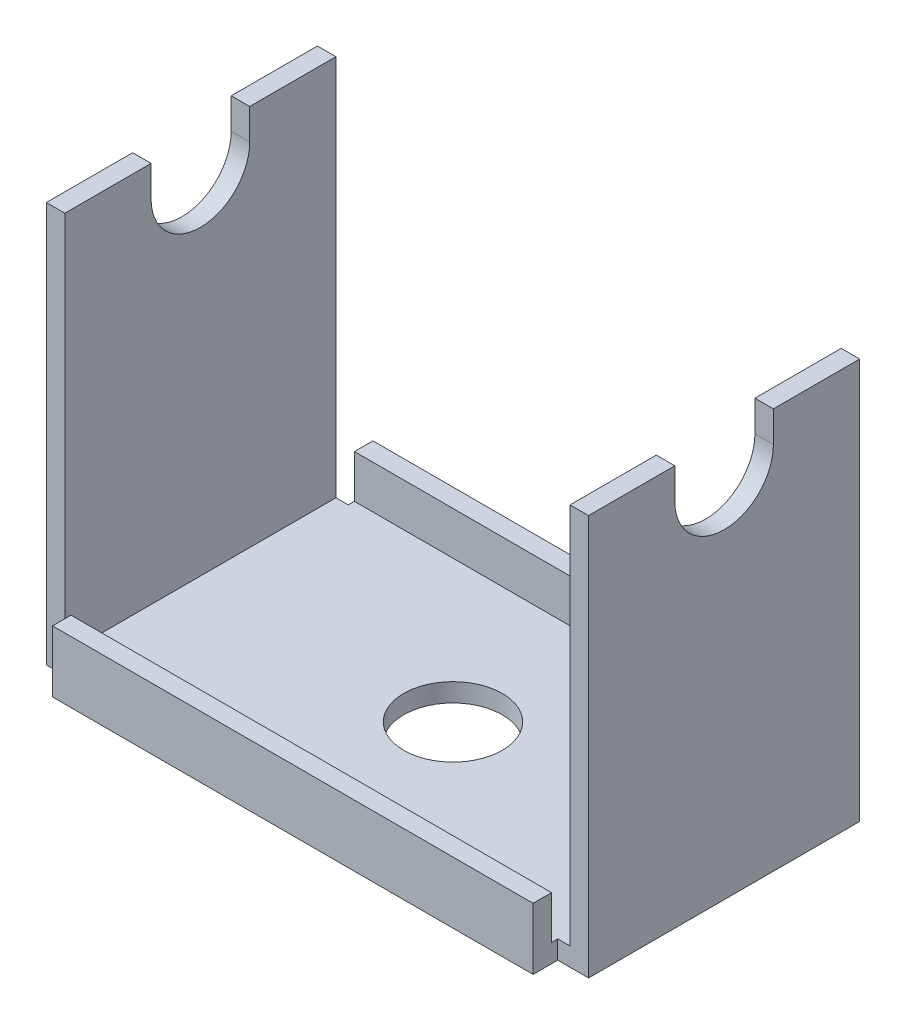
from build123d import *

# Parameters (mm, degrees)
BOSS_EXTRUDE1_DEPTH = 11
BOSS_EXTRUDE2_DEPTH = 19.5
SKETCH3_R           = 4
CUT_EXTRUDE1_DEPTH  = 41.174618853
CUT_EXTRUDE2_DEPTH  = 55.817880295


with BuildPart() as part:
    # Sketch1 → Boss-Extrude1 (new, symmetric)
    with BuildSketch(Plane.XY):
        Polygon((-22, 2.5), (-22, -30), (22, -30), (22, 2.5), (20.5, 2.5), (20.5, -28.5), (-20.5, -28.5), (-20.5, 2.5), align=None)
    extrude(amount=BOSS_EXTRUDE1_DEPTH, both=True)

    # Sketch2 → Boss-Extrude2 (add, symmetric)
    with BuildSketch(Plane(origin=(0, 0, 0), x_dir=(0, 0, -1), z_dir=(1, 0, 0))):
        Polygon((-11, -30), (-13, -30), (-13, -25), (-11.5, -25), (-11.5, -28.5), (-11, -28.5), align=None)
    boss_extrude2 = extrude(amount=BOSS_EXTRUDE2_DEPTH, both=True)

    # Mirror1: Boss-Extrude2 across plane
    add(boss_extrude2.mirror(Plane.XY))

    # Sketch3 → Cut-Extrude1 (cut, through all)
    with BuildSketch(Plane(origin=(0, -28.5, 0), x_dir=(-1, 0, 0), z_dir=(0, 1, 0))):
        Circle(SKETCH3_R)
    extrude(amount=-CUT_EXTRUDE1_DEPTH, mode=Mode.SUBTRACT)

    # Sketch4 → Cut-Extrude2 (cut, through all)
    with BuildSketch(Plane(origin=(22, 0, 0), x_dir=(0, 0, -1), z_dir=(1, 0, 0))):
        with BuildLine():
            Line((-4, 0), (-4, 2.5))
            Line((-4, 2.5), (4, 2.5))
            Line((4, 2.5), (4, 0))
            ThreePointArc((4, 0), (0, -4), (-4, 0))
        make_face()
    extrude(amount=-CUT_EXTRUDE2_DEPTH, mode=Mode.SUBTRACT)


solid = part.part
